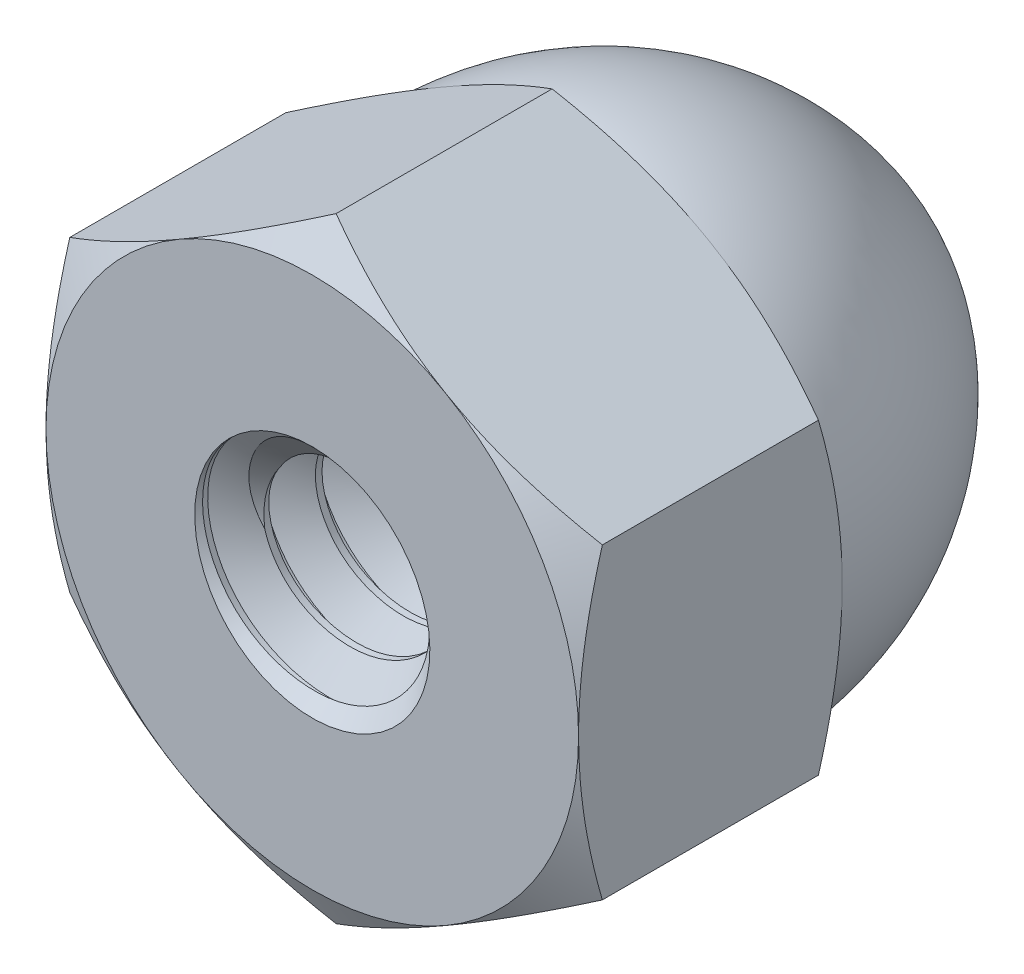
from build123d import *

# Parameters (mm, degrees)
EXTRUDE1_DEPTH     = 3.9290625
SKETCH2_OUTSIDE_W  = 40.976
SKETCH2_OUTSIDE_H  = 42.204
SKETCH2_OUTSIDE_R  = 3.96875
CUT_EXTRUDE1_DEPTH = 8.224251572
CUT_EXTRUDE1_DRAFT = -60
SKETCH3_OUTSIDE_W  = 40.976
SKETCH3_OUTSIDE_H  = 42.204
SKETCH3_OUTSIDE_R  = 3.96875
CUT_EXTRUDE2_DEPTH = 8.224251572
CUT_EXTRUDE2_DRAFT = -60
SKETCH4_R          = 1.7526
CUT_EXTRUDE3_DEPTH = 3.96875
SWEEP1_PITCH       = 0.79375
CUT_EXTRUDE8_DEPTH = 11.629534609


with BuildPart() as part:
    # Sketch1 → Extrude1 (new body)
    with BuildSketch(Plane.XY):
        Polygon((0, 4.582717762), (-3.96875, 2.291358881), (-3.96875, -2.291358881), (0, -4.582717762), (3.96875, -2.291358881), (3.96875, 2.291358881), align=None)
    extrude(amount=-EXTRUDE1_DEPTH)


with BuildPart() as cut_extrude1_tool:
    # Sketch2 outside → Cut-Extrude1 (with draft: the straight prism first)
    with BuildSketch(Plane.XY):
        Rectangle(SKETCH2_OUTSIDE_W, SKETCH2_OUTSIDE_H)
        Circle(SKETCH2_OUTSIDE_R, mode=Mode.SUBTRACT)
    extrude(amount=-CUT_EXTRUDE1_DEPTH)
    # Cut-Extrude1: the draft: its side faces are tilted about the plane it starts from
    cut_extrude1_sides = [cut_extrude1_tool.faces().sort_by_distance(p)[0] for p in [
        (0, -21.102, -4.112125786),
        (20.488, 0, -4.112125786),
        (0, 21.102, -4.112125786),
        (-20.488, 0, -4.112125786),
        (-3.96875, 0, -4.112125786),
    ]]
    draft(cut_extrude1_sides, Plane.XY, CUT_EXTRUDE1_DRAFT)


with BuildPart() as part_1:
    add(part.part)

    # Cut-Extrude1: cut by cut_extrude1_tool
    add(cut_extrude1_tool.part, mode=Mode.SUBTRACT)


with BuildPart() as cut_extrude2_tool:
    # Sketch3 outside → Cut-Extrude2 (with draft: the straight prism first)
    with BuildSketch(Plane(origin=(0, 0, -3.9290625), x_dir=(-1, 0, 0), z_dir=(0, 0, -1))):
        Rectangle(SKETCH3_OUTSIDE_W, SKETCH3_OUTSIDE_H)
        Circle(SKETCH3_OUTSIDE_R, mode=Mode.SUBTRACT)
    extrude(amount=-CUT_EXTRUDE2_DEPTH)
    # Cut-Extrude2: the draft: its side faces are tilted about the plane it starts from
    cut_extrude2_sides = [cut_extrude2_tool.faces().sort_by_distance(p)[0] for p in [
        (0, -21.102, 0.183063286),
        (-20.488, 0, 0.183063286),
        (0, 21.102, 0.183063286),
        (20.488, 0, 0.183063286),
        (3.96875, 0, 0.183063286),
    ]]
    draft(cut_extrude2_sides, Plane(origin=(0, 0, -3.9290625), x_dir=(-1, 0, 0), z_dir=(0, 0, -1)), CUT_EXTRUDE2_DRAFT)


with BuildPart() as part_2:
    add(part_1.part)

    # Cut-Extrude2: cut by cut_extrude2_tool
    add(cut_extrude2_tool.part, mode=Mode.SUBTRACT)

    # Sketch14 → Revolve1 (revolve)
    with BuildSketch(Plane(origin=(0, 0, 0), x_dir=(0, 0, -1), z_dir=(1, 0, 0))):
        with BuildLine():
            Line((3.9290625, 3.96875), (3.9290625, 0))
            Line((3.9290625, 0), (8.73125, 0))
            ThreePointArc((8.73125, 0), (7.044025636, 2.848156957), (3.9290625, 3.96875))
        make_face()
    revolve(axis=Axis((0, 0, 0), (0, 0, -1)))

    # Sketch4 → Cut-Extrude3 (cut)
    with BuildSketch(Plane.XY):
        Circle(SKETCH4_R)
    extrude(amount=-CUT_EXTRUDE3_DEPTH, mode=Mode.SUBTRACT)

    # Sweep1: the profile of Sketch16 profile screwed along a left-hand helix of 9 turns, 6 arcs to a turn; built about Z, then put on its axis
    sweep1_z = Axis((0, 0, 0), (0, 0, 1))
    sweep1_corners = [(1.7529, 0, 0.000173205), (1.7529, 0, -0.694704455), (1.237044252, 0, -0.396875), (1.237044252, 0, -0.29765625)]
    with BuildLine(mode=Mode.PRIVATE) as sweep1_profile:
        Line(sweep1_corners[0], sweep1_corners[1])
        Line(sweep1_corners[1], sweep1_corners[2])
        Line(sweep1_corners[2], sweep1_corners[3])
        Line(sweep1_corners[3], sweep1_corners[0])
    sweep1_cap = Face(sweep1_profile.wire())
    sweep1_turn_angles = [0, -30, -60, -90, -120, -150, -180, -210, -240, -270, -300, -330, -360]
    sweep1_turn_weights = [1, 0.8660254037844387, 1, 0.8660254037844387, 1, 0.8660254037844387, 1, 0.8660254037844387, 1, 0.8660254037844387, 1, 0.8660254037844387, 1]
    sweep1_turn_rails = [Edge.make_bspline([Vector(p[0], p[1], 0).rotate(sweep1_z, sweep1_turn_angles[k]) / sweep1_turn_weights[k] + Vector(0, 0, p[2] + -SWEEP1_PITCH * sweep1_turn_angles[k] / 360) for k in range(13)], [0, 0, 0, 1, 1, 2, 2, 3, 3, 4, 4, 5, 5, 6, 6, 6], 2, sweep1_turn_weights) for p in sweep1_corners]
    sweep1_turn_sides = [Face.make_surface_from_curves(sweep1_turn_rails[p[0]], sweep1_turn_rails[p[1]]) for p in [(0, 1), (1, 2), (2, 3), (3, 0)]]
    sweep1 = Plane(origin=(0, 0, -3.96875), x_dir=(0, 1, 0), z_dir=(0, 0, 1)) * Solid(Shell([*[p.moved(Location((0, 0, SWEEP1_PITCH * i))) for i in range(9) for p in sweep1_turn_sides], sweep1_cap, sweep1_cap.rotate(sweep1_z, -3240).moved(Location((0, 0, -SWEEP1_PITCH * -3240 / 360)))]))
    add(sweep1)

    # Sketch17 → Cut-Extrude8 (cut, through all)
    with BuildSketch(Plane.XY):
        Polygon((0, 4.582717762), (-3.96875, 2.291358881), (-3.96875, -2.291358881), (0, -4.582717762), (3.96875, -2.291358881), (3.96875, 2.291358881), align=None)
    extrude(amount=CUT_EXTRUDE8_DEPTH, mode=Mode.SUBTRACT)

    # Cut-Extrude9 cone 1 section (through the dimple's axis) → Cut-Extrude9 (revolve, cut)
    with BuildSketch(Plane(origin=(0, 0, 0), x_dir=(0, -1, 0), z_dir=(1, 0, 0))):
        Polygon((0, 0), (1.7526, 0), (0, 1.7526), align=None)
    revolve(axis=Axis((0, 0, 0), (0, 0, -1)), mode=Mode.SUBTRACT)

    # Sketch20 → Cut-Revolve1 (revolve, cut)
    with BuildSketch(Plane(origin=(0, 0, 0), x_dir=(0, 0, -1), z_dir=(1, 0, 0))):
        Polygon((4.365625, 1.7526), (5.377489082, 0), (3.96875, 0), (3.96875, 1.7526), align=None)
    revolve(axis=Axis((0, 0, 0), (0, 0, 1)), mode=Mode.SUBTRACT)


solid = part_2.part
